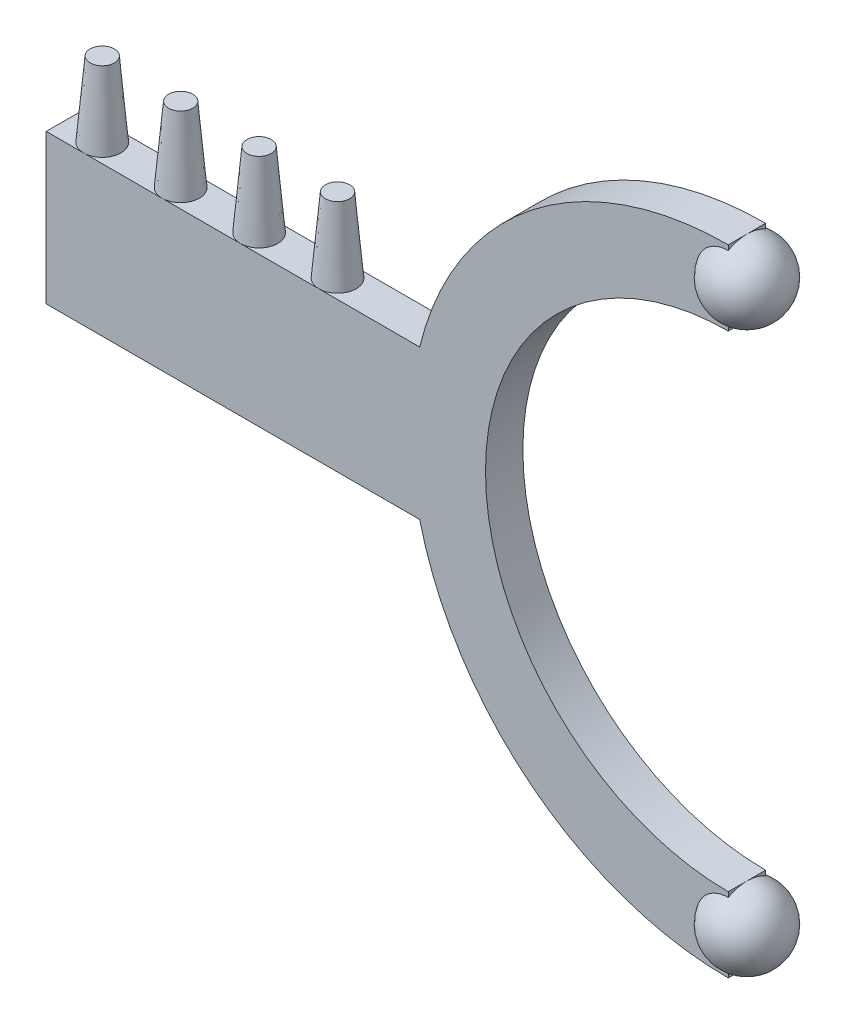
from build123d import *

# Parameters (mm, degrees)
BOSS_EXTRUDE1_DEPTH           = 0.5
SKETCH2_R                     = 0.5
BOSS_EXTRUDE2_DEPTH           = 2
BOSS_EXTRUDE2_DRAFT           = 5
BOSS_EXTRUDE2_PROFILE_2_DEPTH = 2
BOSS_EXTRUDE2_PROFILE_2_DRAFT = 5
BOSS_EXTRUDE2_PROFILE_3_DEPTH = 2
BOSS_EXTRUDE2_PROFILE_3_DRAFT = 5
BOSS_EXTRUDE2_PROFILE_4_DEPTH = 2
BOSS_EXTRUDE2_PROFILE_4_DRAFT = 5


with BuildPart() as part:
    # Sketch1 → Boss-Extrude1 (new, symmetric)
    with BuildSketch(Plane.XY):
        with BuildLine():
            Line((-8.261355821, 2), (-18.261355821, 2))
            Line((-18.261355821, 2), (-18.261355821, -2))
            Line((-18.261355821, -2), (-8.261355821, -2))
            ThreePointArc((-8.261355821, -2), (-5.25594901, -6.680194608), (0, -8.5))
            Line((0, -8.5), (0, -6.5))
            ThreePointArc((0, -6.5), (-6.5, 0), (0, 6.5))
            Line((0, 6.5), (0, 8.5))
            ThreePointArc((0, 8.5), (-5.25594901, 6.680194608), (-8.261355821, 2))
        make_face()
    extrude(amount=BOSS_EXTRUDE1_DEPTH, both=True)

    # Sketch1<7> → Revolve14 (revolve)
    with BuildSketch(Plane.XY):
        with BuildLine():
            Line((0, 6.5), (0, 8.5))
            ThreePointArc((0, 8.5), (-1, 7.5), (0, 6.5))
        make_face()
        with BuildLine():
            ThreePointArc((0, -6.5), (-1, -7.5), (0, -8.5))
            Line((0, -8.5), (0, -6.5))
        make_face()
    revolve(axis=Axis((0, 0, 0), (0, 1, 0)))


with BuildPart() as boss_extrude2_tool:
    # Sketch2 → Boss-Extrude2 (with draft: the straight prism first)
    with BuildSketch(Plane(origin=(0, 2, 0), x_dir=(1, 0, 0), z_dir=(0, 1, 0))):
        with Locations((-17.261355821, 0)):
            Circle(SKETCH2_R)
    extrude(amount=BOSS_EXTRUDE2_DEPTH)
    # Boss-Extrude2: the draft: its side faces are tilted about the plane it starts from
    boss_extrude2_sides = [boss_extrude2_tool.faces().sort_by_distance(p)[0] for p in [
        (-17.761355821, 3, 0),
    ]]
    draft(boss_extrude2_sides, Plane(origin=(0, 2, 0), x_dir=(1, 0, 0), z_dir=(0, 1, 0)), BOSS_EXTRUDE2_DRAFT)


with BuildPart() as part_1:
    add(part.part)

    # Boss-Extrude2: add boss_extrude2_tool
    add(boss_extrude2_tool.part)


with BuildPart() as boss_extrude2_profile_2_tool:
    # Sketch2 → Boss-Extrude2 profile 2 (with draft: the straight prism first)
    with BuildSketch(Plane(origin=(0, 2, 0), x_dir=(1, 0, 0), z_dir=(0, 1, 0))):
        with Locations((-15.161355821, 0)):
            Circle(SKETCH2_R)
    extrude(amount=BOSS_EXTRUDE2_PROFILE_2_DEPTH)
    # Boss-Extrude2 profile 2: the draft: its side faces are tilted about the plane it starts from
    boss_extrude2_profile_2_sides = [boss_extrude2_profile_2_tool.faces().sort_by_distance(p)[0] for p in [
        (-15.661355821, 3, 0),
    ]]
    draft(boss_extrude2_profile_2_sides, Plane(origin=(0, 2, 0), x_dir=(1, 0, 0), z_dir=(0, 1, 0)), BOSS_EXTRUDE2_PROFILE_2_DRAFT)


with BuildPart() as part_2:
    add(part_1.part)

    # Boss-Extrude2 profile 2: add boss_extrude2_profile_2_tool
    add(boss_extrude2_profile_2_tool.part)


with BuildPart() as boss_extrude2_profile_3_tool:
    # Sketch2 → Boss-Extrude2 profile 3 (with draft: the straight prism first)
    with BuildSketch(Plane(origin=(0, 2, 0), x_dir=(1, 0, 0), z_dir=(0, 1, 0))):
        with Locations((-13.061355821, 0)):
            Circle(SKETCH2_R)
    extrude(amount=BOSS_EXTRUDE2_PROFILE_3_DEPTH)
    # Boss-Extrude2 profile 3: the draft: its side faces are tilted about the plane it starts from
    boss_extrude2_profile_3_sides = [boss_extrude2_profile_3_tool.faces().sort_by_distance(p)[0] for p in [
        (-13.561355821, 3, 0),
    ]]
    draft(boss_extrude2_profile_3_sides, Plane(origin=(0, 2, 0), x_dir=(1, 0, 0), z_dir=(0, 1, 0)), BOSS_EXTRUDE2_PROFILE_3_DRAFT)


with BuildPart() as part_3:
    add(part_2.part)

    # Boss-Extrude2 profile 3: add boss_extrude2_profile_3_tool
    add(boss_extrude2_profile_3_tool.part)


with BuildPart() as boss_extrude2_profile_4_tool:
    # Sketch2 → Boss-Extrude2 profile 4 (with draft: the straight prism first)
    with BuildSketch(Plane(origin=(0, 2, 0), x_dir=(1, 0, 0), z_dir=(0, 1, 0))):
        with Locations((-10.961355821, 0)):
            Circle(SKETCH2_R)
    extrude(amount=BOSS_EXTRUDE2_PROFILE_4_DEPTH)
    # Boss-Extrude2 profile 4: the draft: its side faces are tilted about the plane it starts from
    boss_extrude2_profile_4_sides = [boss_extrude2_profile_4_tool.faces().sort_by_distance(p)[0] for p in [
        (-11.461355821, 3, 0),
    ]]
    draft(boss_extrude2_profile_4_sides, Plane(origin=(0, 2, 0), x_dir=(1, 0, 0), z_dir=(0, 1, 0)), BOSS_EXTRUDE2_PROFILE_4_DRAFT)


with BuildPart() as part_4:
    add(part_3.part)

    # Boss-Extrude2 profile 4: add boss_extrude2_profile_4_tool
    add(boss_extrude2_profile_4_tool.part)


solid = part_4.part
